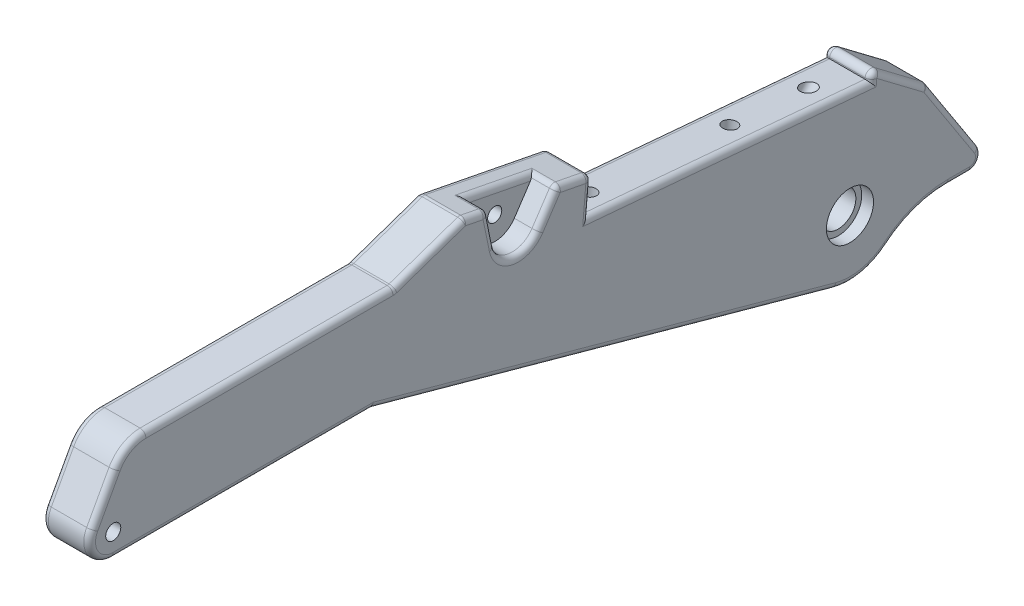
from build123d import *

# Parameters (mm, degrees)
SKETCH1_R           = 2.032
BOSS_EXTRUDE1_DEPTH = 12.7
FILLET1_R           = 9.525
SKETCH2_R           = 4.7625
CUT_EXTRUDE1_DEPTH  = 238.90790865
SKETCH4_R           = 6.35
CUT_EXTRUDE2_DEPTH  = 3.175
CUT_EXTRUDE6_DEPTH  = 6.35
SKETCH10_R          = 1.905
CUT_EXTRUDE7_DEPTH  = 238.653540891
FILLET2_R           = 1.5875
SKETCH6_R           = 1.905
CUT_EXTRUDE3_DEPTH  = 25.4
SKETCH7_R           = 1.905
CUT_EXTRUDE4_DEPTH  = 15.875
SKETCH8_R           = 1.905
CUT_EXTRUDE5_DEPTH  = 12.7


with BuildPart() as part:
    # Sketch1 → Boss-Extrude1 (new body)
    with BuildSketch(Plane(origin=(0, 0, 0), x_dir=(0, 0, -1), z_dir=(1, 0, 0))):
        with BuildLine():
            Line((-5.574599012, 3.040780467), (3.157961292, 19.05))
            Line((3.157961292, 19.05), (75.662744852, 19.05))
            Line((75.662744852, 19.05), (94.776183001, 25.614386431))
            Line((94.776183001, 25.614386431), (129.054233098, 18.923279907))
            Line((129.054233098, 18.923279907), (128.224074649, 9.434525408))
            Line((128.224074649, 9.434525408), (204.134110643, 2.79325781))
            Line((204.134110643, 2.79325781), (204.161005679, 3.100669472))
            ThreePointArc((204.161005679, 3.100669472), (205.09730431, 4.412800765), (206.698779384, 4.229439793))
            Line((206.698779384, 4.229439793), (219.392961654, -5.350975413))
            ThreePointArc((219.392961654, -5.350975413), (219.598467913, -5.536288257), (219.768672831, -5.75447157))
            Line((219.768672831, -5.75447157), (233.444725546, -26.84773219))
            ThreePointArc((233.444725546, -26.84773219), (233.570360338, -30.091006218), (230.780673949, -31.75))
            Line((230.780673949, -31.75), (224.896696771, -31.75))
            ThreePointArc((224.896696771, -31.75), (216.268745771, -33.260285445), (208.666831685, -37.611538462))
            ThreePointArc((208.666831685, -37.611538462), (201.862183679, -40.919877125), (194.299038193, -40.702691568))
            Line((194.299038193, -40.702691568), (69.85, -6.35))
            Line((69.85, -6.35), (0, -6.35))
            ThreePointArc((0, -6.35), (-5.460378007, -3.241415126), (-5.574599012, 3.040780467))
        make_face()
        Circle(SKETCH1_R, mode=Mode.SUBTRACT)
    extrude(amount=BOSS_EXTRUDE1_DEPTH)

    # Fillet1
    fillet1_edges = [part.edges().sort_by_distance(p)[0] for p in [
        (6.35, 19.05, -3.157961292),
    ]]
    fillet(fillet1_edges, radius=FILLET1_R)

    # Sketch2 → Cut-Extrude1 (cut, through all)
    with BuildSketch(Plane.ZY):
        with Locations((-198.523166007, -25.4)):
            Circle(SKETCH2_R)
    extrude(amount=-CUT_EXTRUDE1_DEPTH, mode=Mode.SUBTRACT)

    # Sketch4 → Cut-Extrude2 (cut)
    with BuildSketch(Plane(origin=(12.7, 0, 0), x_dir=(0, 0, -1), z_dir=(1, 0, 0))):
        with Locations((198.523166007, -25.4)):
            Circle(SKETCH4_R)
    extrude(amount=-CUT_EXTRUDE2_DEPTH, mode=Mode.SUBTRACT)

    # Sketch9 → Cut-Extrude6 (cut)
    with BuildSketch(Plane(origin=(12.7, 0, 0), x_dir=(0, 0, -1), z_dir=(1, 0, 0))):
        with BuildLine():
            Line((102.919681037, 15.066518102), (101.008555746, 24.397821608))
            Line((101.008555746, 24.397821608), (119.705673981, 20.748127141))
            Line((119.705673981, 20.748127141), (114.425599951, 12.820552276))
            ThreePointArc((114.425599951, 12.820552276), (107.923985218, 10.108228884), (102.919681037, 15.066518102))
        make_face()
    extrude(amount=-CUT_EXTRUDE6_DEPTH, mode=Mode.SUBTRACT)

    # Sketch10 → Cut-Extrude7 (cut, through all)
    with BuildSketch(Plane(origin=(6.35, 0, 0), x_dir=(0, 0, -1), z_dir=(1, 0, 0))):
        with Locations((109.140550041, 16.340601629)):
            Circle(SKETCH10_R)
    extrude(amount=-CUT_EXTRUDE7_DEPTH, mode=Mode.SUBTRACT)

    # Fillet2
    fillet2_edges = [part.edges().sort_by_distance(p)[0] for p in [
        (0, 2.946963641, -204.147558161),
        (0, 4.412800765, -205.09730431),
        (0, -0.56076781, -213.045870519),
        (0, -5.536288257, -219.598467913),
        (0, -16.30110188, -226.606699189),
        (0, -30.091006218, -233.570360338),
        (0, -31.75, -227.83868536),
        (0, -33.260285445, -216.268745771),
        (0, -40.919877125, -201.862183679),
        (0, -6.35, -34.925),
        (0, -3.241415126, 5.460378007),
        (0, 8.563475584, 2.5621306),
        (0, 17.715567011, -3.950113643),
        (12.7, 2.946963641, -204.147558161),
        (12.7, 4.412800765, -205.09730431),
        (12.7, -0.56076781, -213.045870519),
        (12.7, -5.536288257, -219.598467913),
        (12.7, -16.30110188, -226.606699189),
        (12.7, -30.091006218, -233.570360338),
        (12.7, -31.75, -227.83868536),
        (12.7, -33.260285445, -216.268745771),
        (12.7, -40.919877125, -201.862183679),
        (12.7, -6.35, -34.925),
        (12.7, -3.241415126, 5.460378007),
        (12.7, 8.563475584, 2.5621306),
        (12.7, 17.715567011, -3.950113643),
        (0, -23.526345784, -132.074519097),
        (0, 6.113891609, -166.179092646),
        (0, 14.178902657, -128.639153874),
        (0, 19.05, -42.237490592),
        (12.7, -23.526345784, -132.074519097),
        (12.7, 6.113891609, -166.179092646),
        (12.7, 14.178902657, -128.639153874),
        (12.7, 19.05, -42.237490592),
        (12.7, 19.732169855, -101.964118391),
        (12.7, 16.784339708, -117.065636966),
        (12.7, 10.108228884, -107.923985218),
        (12.7, 19.835703524, -124.37995354),
        (0, 22.268833169, -111.91520805),
        (9.525, 20.748127141, -119.705673981),
        (9.525, 24.397821608, -101.008555746),
        (6.35, 22.572974375, -110.357114863),
        (12.7, 25.006104019, -97.892369373),
        (12.7, 22.332193215, -85.219463927),
        (0, 22.332193215, -85.219463927),
        (6.35, 25.614386431, -94.776183001),
        (6.35, 19.05, -75.662744852),
        (6.35, 18.923279907, -129.054233098),
    ]]
    fillet(fillet2_edges, radius=FILLET2_R)

    # Sketch6 → Cut-Extrude3 (cut)
    with BuildSketch(Plane(origin=(0, 102.082274381, -77.04242407), x_dir=(1, 0, 0), z_dir=(0, 0.798192165141452, -0.6024029112701905))):
        with Locations((6.35, 152.364748226)):
            Circle(SKETCH6_R)
    extrude(amount=-CUT_EXTRUDE3_DEPTH, mode=Mode.SUBTRACT)

    # Sketch7 → Cut-Extrude4 (cut)
    with BuildSketch(Plane(origin=(0, 20.495798036, -1.793149978), x_dir=(1, 0, 0), z_dir=(0, 0.996194698091746, -0.0871557427476538))):
        with Locations((6.35, 171.363870263)):
            Circle(SKETCH7_R)
        with Locations((6.35, 133.263870263)):
            Circle(SKETCH7_R)
    extrude(amount=-CUT_EXTRUDE4_DEPTH, mode=Mode.SUBTRACT)

    # Sketch8 → Cut-Extrude5 (cut)
    with BuildSketch(Plane(origin=(0, 98.615320401, -152.099344577), x_dir=(-1, 0, 0), z_dir=(0, 0.5440213575001199, -0.839071369183651))):
        with Locations((-6.35, -139.982344987)):
            Circle(SKETCH8_R)
    extrude(amount=-CUT_EXTRUDE5_DEPTH, mode=Mode.SUBTRACT)


solid = part.part
